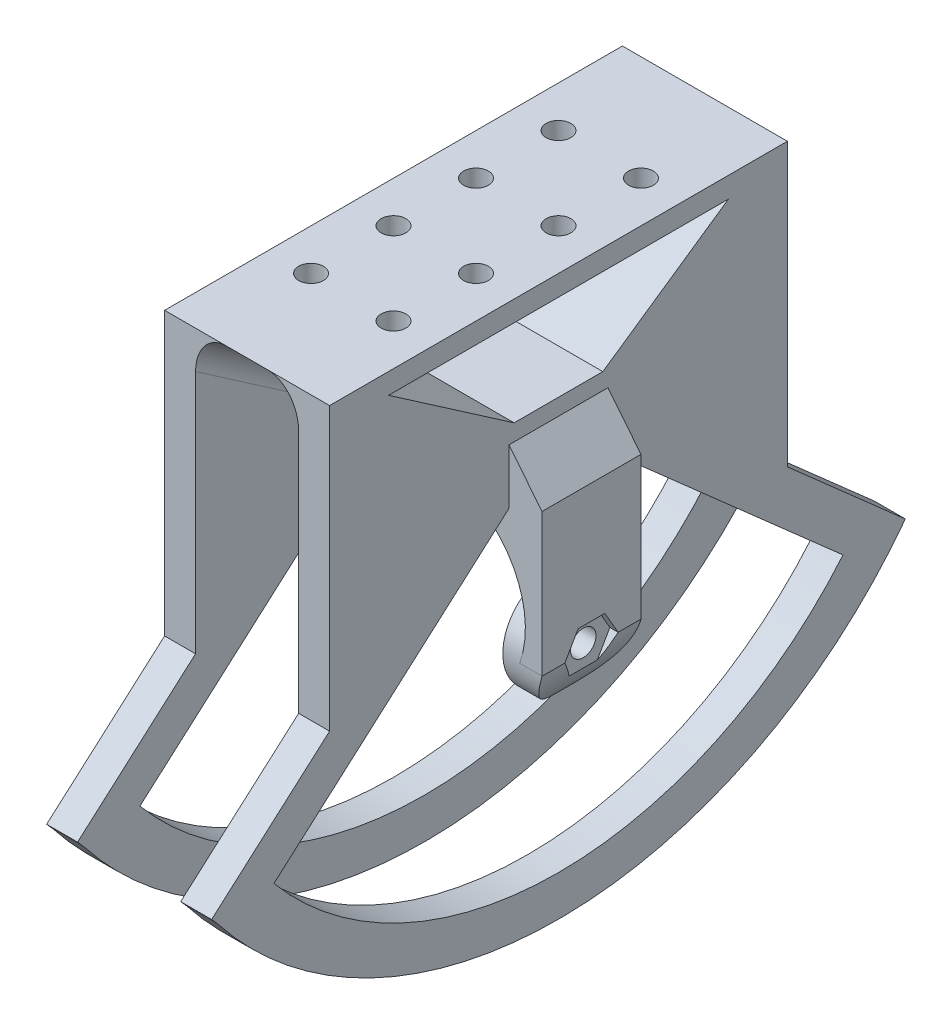
from build123d import *

# Parameters (mm, degrees)
EXTRUDE_1_DEPTH      = 12
EXTRUDE_2_REACH      = 35.545
EXTRUDE_2_END_RADIUS = 11.985372339
SKETCH_2_R           = 6
MIRROR_START         = 9.249795062
MIRROR_1_DEPTH       = 2.735782315
MIRROR_1_2_DEPTH     = 0.000409876
CUT_EXTRUDE_1_DEPTH  = 34.545141776
CUT_EXTRUDE_2_DEPTH  = 1
CUT_EXTRUDE_3_DEPTH  = 1
MIRROR_START_2       = 9.250204938
MIRROR_3_DEPTH       = 5.749795062
SKETCH_6_R           = 1.55
CUT_EXTRUDE_4_DEPTH  = 37.245193425
SKETCH_12_W          = 20
SKETCH_12_H          = 12
EXTRUDE_4_DEPTH      = 5
EXTRUDE_5_DEPTH      = 10
EXTRUDE_6_DEPTH      = 12
EXTRUDE_7_DEPTH      = 3.75
EXTRUDE_8_DEPTH      = 3.75
FILLET_1_R           = 3.75
SKETCH_21_R          = 1.5
CUT_EXTRUDE_5_DEPTH  = 3


with BuildPart() as part:
    # 스케치1 → 보스-돌출1 (new body)
    with BuildSketch(Plane.XY):
        with BuildLine():
            Line((14.000204938, 2.291069809), (-13.999795062, 2.291069809))
            Line((-13.999795062, 2.291069809), (-13.999795062, -6.939240191))
            Line((-13.999795062, -6.939240191), (-13.999795062, -15.005030191))
            ThreePointArc((-13.999795062, -15.005030191), (-12.699794, -18.209549332), (-10.647895062, -20.993190191))
            Line((-10.647895062, -20.993190191), (-9.249795062, -20.993190191))
            Line((-9.249795062, -20.993190191), (-9.249795062, -18.61185417))
            ThreePointArc((-9.249795062, -18.61185417), (-10.428409882, -16.897436148), (-11.292795062, -15.005030191))
            ThreePointArc((-11.292795062, -15.005030191), (0.000204938, 0.99497801), (11.293204938, -15.005030191))
            ThreePointArc((11.293204938, -15.005030191), (10.428819757, -16.897436148), (9.250204938, -18.61185417))
            Line((9.250204938, -18.61185417), (9.250204938, -20.993190191))
            Line((9.250204938, -20.993190191), (10.648304938, -20.993190191))
            ThreePointArc((10.648304938, -20.993190191), (12.700203875, -18.209549332), (14.000204938, -15.005030191))
            Line((14.000204938, -15.005030191), (14.000204938, -6.939240191))
            Line((14.000204938, -6.939240191), (14.000204938, 2.291069809))
        make_face()
    extrude(amount=EXTRUDE_1_DEPTH)

    # 보스-돌출2: up to this cylinder (the profile starts inside it)
    extrude_2_end = Plane(origin=(0.000204938, -10.990394329, 6), z_dir=(0, 0, -1)) * Cylinder(EXTRUDE_2_END_RADIUS, 96.060744678, mode=Mode.PRIVATE)
    # 스케치2 → 보스-돌출2 (add, up to the surface)
    with BuildSketch(Plane(origin=(-9.249795062, 0, 0), x_dir=(0, 0, -1), z_dir=(1, 0, 0)), mode=Mode.PRIVATE) as extrude_2_sk1:
        with Locations((-6, -14.993190191)):
            Circle(SKETCH_2_R)
    extrude_2_tool1 = extrude(extrude_2_sk1.sketch, amount=-EXTRUDE_2_REACH, mode=Mode.PRIVATE) & extrude_2_end
    add(extrude_2_tool1.solids().sort_by_distance((-9.249795, -14.99319, 6))[0])

    # 대칭 복사1: read off the stored shape, not the designer's step
    # 대칭 복사1 outline → 대칭 복사1 (add)
    with BuildSketch(Plane.YZ.offset(MIRROR_START)):
        with BuildLine():
            ThreePointArc((-18.61185417, 1.214054847), (-8.993190191, 6), (-18.61185417, 10.785945153))
            Line((-18.61185417, 10.785945153), (-18.61185417, 1.214054847))
        make_face()
    extrude(amount=MIRROR_1_DEPTH)

    # Mirror 1 2 outline → Mirror 1 2 (add)
    with BuildSketch(Plane.YZ.offset(MIRROR_START)):
        with BuildLine():
            Line((-18.61185417, 1.214054847), (-18.61185417, 10.785945153))
            ThreePointArc((-18.61185417, 10.785945153), (-20.993190191, 6), (-18.61185417, 1.214054847))
        make_face()
    extrude(amount=MIRROR_1_2_DEPTH)

    # 스케치3 → 컷-돌출1 (cut, through all)
    with BuildSketch(Plane(origin=(-9.249795062, 0, 0), x_dir=(0, 0, -1), z_dir=(1, 0, 0))):
        with BuildLine():
            Line((-6, -20.993190191), (0, -20.993190191))
            Line((0, -20.993190191), (0, -18.61185417))
            Line((0, -18.61185417), (-1.214054847, -18.61185417))
            ThreePointArc((-1.214054847, -18.61185417), (-3.327172272, -20.364967545), (-6, -20.993190191))
        make_face()
        with BuildLine():
            Line((-12, -20.993190191), (-6, -20.993190191))
            ThreePointArc((-6, -20.993190191), (-8.672827728, -20.364967545), (-10.785945153, -18.61185417))
            Line((-10.785945153, -18.61185417), (-12, -18.61185417))
            Line((-12, -18.61185417), (-12, -20.993190191))
        make_face()
        with BuildLine():
            Line((-12, -18.61185417), (-10.785945153, -18.61185417))
            ThreePointArc((-10.785945153, -18.61185417), (-11.688394805, -16.901635773), (-12, -14.993190191))
            Line((-12, -14.993190191), (-12, -18.61185417))
        make_face()
        with BuildLine():
            Line((-1.214054847, -18.61185417), (0, -18.61185417))
            Line((0, -18.61185417), (0, -14.993190191))
            ThreePointArc((0, -14.993190191), (-0.311605195, -16.901635773), (-1.214054847, -18.61185417))
        make_face()
    extrude(amount=-CUT_EXTRUDE_1_DEPTH, mode=Mode.SUBTRACT)

    # 스케치4 → 컷-돌출2 (cut)
    with BuildSketch(Plane.ZY.offset(13.999795062)):
        Polygon((9.23, -15.005030191), (7.615, -12.207768137), (4.385, -12.207768137), (2.77, -15.005030191), (4.385, -17.802292245), (7.615, -17.802292245), align=None)
    extrude(amount=-CUT_EXTRUDE_2_DEPTH, mode=Mode.SUBTRACT)

    # 스케치5 → 컷-돌출3 (cut)
    with BuildSketch(Plane(origin=(14.000204938, 0, 0), x_dir=(0, 0, -1), z_dir=(1, 0, 0))):
        Polygon((-2.77, -15.005030191), (-4.385, -12.207768137), (-7.615, -12.207768137), (-9.23, -15.005030191), (-7.615, -17.802292245), (-4.385, -17.802292245), align=None)
    extrude(amount=-CUT_EXTRUDE_3_DEPTH, mode=Mode.SUBTRACT)

    # 대칭 복사3: read off the stored shape, not the designer's step
    # 대칭 복사3 outline → 대칭 복사3 (cut)
    with BuildSketch(Plane.YZ.offset(MIRROR_START_2)):
        with BuildLine():
            ThreePointArc((-20.993190191, 6), (-19.235830878, 10.242640687), (-14.993190191, 12))
            Line((-14.993190191, 12), (-20.993190191, 12))
            Line((-20.993190191, 12), (-20.993190191, 6))
        make_face()
        with BuildLine():
            Line((-20.993190191, 0), (-14.993190191, 0))
            ThreePointArc((-14.993190191, 0), (-19.235830878, 1.757359313), (-20.993190191, 6))
            Line((-20.993190191, 6), (-20.993190191, 0))
        make_face()
    extrude(amount=MIRROR_3_DEPTH, mode=Mode.SUBTRACT)

    # 스케치6 → 컷-돌출4 (cut, through all)
    with BuildSketch(Plane.ZY.offset(12.999795062)):
        with Locations((6, -15.005030191)):
            Circle(SKETCH_6_R)
    extrude(amount=-CUT_EXTRUDE_4_DEPTH, mode=Mode.SUBTRACT)

    # 스케치12 → 보스-돌출4 (add)
    with BuildSketch(Plane(origin=(0, 2.291069809, 0), x_dir=(1, 0, 0), z_dir=(0, 1, 0))):
        with Locations((0, -6)):
            Rectangle(SKETCH_12_W, SKETCH_12_H)
    extrude(amount=EXTRUDE_4_DEPTH)

    # 스케치14 → 보스-돌출5 (add, symmetric)
    with BuildSketch(Plane(origin=(0, 0, 0), x_dir=(0, 0, -1), z_dir=(1, 0, 0))):
        Polygon((-12, 7.291069809), (0, 7.291069809), (21.75, 22.291069809), (-33.75, 22.291069809), align=None)
        Polygon((-11.377217009, 9.291069809), (-0.622782991, 9.291069809), (14.602217009, 19.791069809), (-26.602217009, 19.791069809), align=None, mode=Mode.SUBTRACT)
    extrude(amount=EXTRUDE_5_DEPTH, both=True)

    # 스케치15 → 보스-돌출6 (add)
    with BuildSketch(Plane.XY.offset(12)):
        Polygon((-10, 7.291069809), (-13.999795062, 2.291069809), (-10, 2.291069809), align=None)
        Polygon((10, 2.291069809), (14.000204938, 2.291069809), (10, 7.291069809), align=None)
    extrude(amount=-EXTRUDE_6_DEPTH)

    # 스케치19 → 보스-돌출7 (add)
    with BuildSketch(Plane(origin=(6.25, 0, 0), x_dir=(0, 0, -1), z_dir=(1, 0, 0))):
        with BuildLine():
            Line((-12, 0.623337928), (-12, 7.291069809))
            Line((-12, 7.291069809), (-48.053184311, -24.516461273))
            Line((-48.053184311, -24.516461273), (-47.300067067, -25.370104227))
            ThreePointArc((-47.300067067, -25.370104227), (-5.412725687, -45.518439989), (36.053184311, -24.516461273))
            Line((36.053184311, -24.516461273), (0, 7.291069809))
            Line((0, 7.291069809), (0, 0.623337928))
            Line((0, 0.623337928), (28.495446937, -24.516461273))
            ThreePointArc((28.495446937, -24.516461273), (-6, -40.618984902), (-40.495446937, -24.516461273))
            Line((-40.495446937, -24.516461273), (-12, 0.623337928))
        make_face()
    extrude_7 = extrude(amount=EXTRUDE_7_DEPTH)

    # 대칭 복사4: 보스-돌출7 across plane
    add(extrude_7.mirror(Plane(origin=(0, 0, 0), x_dir=(0, 0, 1), z_dir=(1, 0, 0))))

    # 스케치20 → 보스-돌출8 (add)
    with BuildSketch(Plane(origin=(10, 0, 0), x_dir=(0, 0, -1), z_dir=(1, 0, 0))):
        Polygon((-12, 7.291069809), (-33.75, 22.291069809), (-33.75, -11.897631945), align=None)
        Polygon((21.75, 22.291069809), (21.75, -11.897631945), (0, 7.291069809), align=None)
    extrude_8 = extrude(amount=-EXTRUDE_8_DEPTH)

    # 대칭 복사5: 보스-돌출8 across plane
    add(extrude_8.mirror(Plane(origin=(0, 0, 0), x_dir=(0, 0, 1), z_dir=(1, 0, 0))))

    # 필렛1
    # the kernel refuses this fillet: 3.75 mm, written as the material it adds along each edge
    with BuildSketch(Plane(origin=(-6.25, 7.291069809, 0), x_dir=(0, -1, 0), z_dir=(1, 0, 0))) as fillet_1_piece_1_section:
        with BuildLine():
            CenterArc((FILLET_1_R * 0.525097583021, FILLET_1_R), FILLET_1_R, 214.592288688, 55.407711312)
            Line((-FILLET_1_R * 0.298115202894, FILLET_1_R * 0.432267044196), (0, 0))
            Line((0, 0), (FILLET_1_R * 0.525097583021, 0))
        make_face()
    fillet_1_piece_1 = extrude(amount=17.422789841, mode=Mode.PRIVATE)
    fillet_1_piece_1 = split(fillet_1_piece_1, bisect_by=Plane(origin=(10, 7.291069809, 0), z_dir=(-1, 0, 0)), keep=Keep.TOP, mode=Mode.PRIVATE)
    add(fillet_1_piece_1)
    with BuildSketch(Plane(origin=(11.172789841, 7.291069809, 12), x_dir=(0, -1, 0), z_dir=(-1, 0, 0))) as fillet_1_piece_2_section:
        with BuildLine():
            CenterArc((FILLET_1_R * 0.525097583021, FILLET_1_R), FILLET_1_R, 214.592288688, 55.407711312)
            Line((-FILLET_1_R * 0.298115202894, FILLET_1_R * 0.432267044196), (0, 0))
            Line((0, 0), (FILLET_1_R * 0.525097583021, 0))
        make_face()
    fillet_1_piece_2 = extrude(amount=17.422789841, mode=Mode.PRIVATE)
    fillet_1_piece_2 = split(fillet_1_piece_2, bisect_by=Plane(origin=(10, 7.291069809, 12), z_dir=(-1, 0, 0)), keep=Keep.TOP, mode=Mode.PRIVATE)
    add(fillet_1_piece_2)
    with BuildSketch(Plane(origin=(6.25, 1.968573348, 4.282380132), x_dir=(-1, 0, 0), z_dir=(0, 0.5677329558036596, 0.8232127859153063))) as fillet_1_piece_3_section:
        with BuildLine():
            CenterArc((FILLET_1_R, FILLET_1_R), FILLET_1_R, 180, 90)
            Line((0, FILLET_1_R), (0, 0))
            Line((0, 0), (FILLET_1_R, 0))
        make_face()
    fillet_1_piece_3 = extrude(amount=45.170872431, mode=Mode.PRIVATE)
    fillet_1_piece_3 = split(fillet_1_piece_3, bisect_by=Plane(origin=(6.25, 1.968573348, 12), z_dir=(0, 0, 1)), keep=Keep.TOP, mode=Mode.PRIVATE)
    fillet_1_piece_3 = split(fillet_1_piece_3, bisect_by=Plane(origin=(6.25, 1.968573348, 33.75), z_dir=(0, 0, -1)), keep=Keep.TOP, mode=Mode.PRIVATE)
    add(fillet_1_piece_3)
    with BuildSketch(Plane(origin=(6.25, 1.968573348, 7.717619868), x_dir=(0, -0.8232127859153062, -0.5677329558036597), z_dir=(0, 0.5677329558036597, -0.8232127859153062))) as fillet_1_piece_4_section:
        with BuildLine():
            CenterArc((FILLET_1_R, FILLET_1_R), FILLET_1_R, 180, 90)
            Line((0, FILLET_1_R), (0, 0))
            Line((0, 0), (FILLET_1_R, 0))
        make_face()
    fillet_1_piece_4 = extrude(amount=45.170872431, mode=Mode.PRIVATE)
    fillet_1_piece_4 = split(fillet_1_piece_4, bisect_by=Plane(origin=(6.25, 1.968573348, 0), z_dir=(0, 0, -1)), keep=Keep.TOP, mode=Mode.PRIVATE)
    fillet_1_piece_4 = split(fillet_1_piece_4, bisect_by=Plane(origin=(6.25, 1.968573348, -21.75), z_dir=(0, 0, 1)), keep=Keep.TOP, mode=Mode.PRIVATE)
    add(fillet_1_piece_4)
    with BuildSketch(Plane(origin=(-6.25, 1.968573348, 4.282380132), x_dir=(0, -0.8232127859153063, 0.5677329558036595), z_dir=(0, 0.5677329558036596, 0.8232127859153063))) as fillet_1_piece_5_section:
        with BuildLine():
            CenterArc((FILLET_1_R, FILLET_1_R), FILLET_1_R, 180, 90)
            Line((0, FILLET_1_R), (0, 0))
            Line((0, 0), (FILLET_1_R, 0))
        make_face()
    fillet_1_piece_5 = extrude(amount=45.170872431, mode=Mode.PRIVATE)
    fillet_1_piece_5 = split(fillet_1_piece_5, bisect_by=Plane(origin=(-6.25, 1.968573348, 12), z_dir=(0, 0, 1)), keep=Keep.TOP, mode=Mode.PRIVATE)
    fillet_1_piece_5 = split(fillet_1_piece_5, bisect_by=Plane(origin=(-6.25, 1.968573348, 33.75), z_dir=(0, 0, -1)), keep=Keep.TOP, mode=Mode.PRIVATE)
    add(fillet_1_piece_5)
    with BuildSketch(Plane(origin=(-6.25, 1.968573348, 7.717619868), x_dir=(0, -0.8232127859153062, -0.5677329558036597), z_dir=(0, 0.5677329558036597, -0.8232127859153062))) as fillet_1_piece_6_section:
        with BuildLine():
            CenterArc((FILLET_1_R, -FILLET_1_R), FILLET_1_R, 90, 90)
            Line((0, -FILLET_1_R), (0, 0))
            Line((0, 0), (FILLET_1_R, 0))
        make_face()
    fillet_1_piece_6 = extrude(amount=45.170872431, mode=Mode.PRIVATE)
    fillet_1_piece_6 = split(fillet_1_piece_6, bisect_by=Plane(origin=(-6.25, 1.968573348, 0), z_dir=(0, 0, -1)), keep=Keep.TOP, mode=Mode.PRIVATE)
    fillet_1_piece_6 = split(fillet_1_piece_6, bisect_by=Plane(origin=(-6.25, 1.968573348, -21.75), z_dir=(0, 0, 1)), keep=Keep.TOP, mode=Mode.PRIVATE)
    add(fillet_1_piece_6)

    # 스케치21 → 컷-돌출5 (cut)
    with BuildSketch(Plane(origin=(0, 22.291069809, 0), x_dir=(1, 0, 0), z_dir=(0, 1, 0))):
        with Locations(Location((5, 9, 0), (0, 0, 270))):
            Circle(SKETCH_21_R)
        with Locations(Location((5, -1, 0), (0, 0, 270))):
            Circle(SKETCH_21_R)
        with Locations(Location((-5, 9, 0), (0, 0, 90))):
            Circle(SKETCH_21_R)
        with Locations(Location((-5, -1, 0), (0, 0, 90))):
            Circle(SKETCH_21_R)
        with Locations(Location((5, -11, 0), (0, 0, 90))):
            Circle(SKETCH_21_R)
        with Locations(Location((5, -21, 0), (0, 0, 90))):
            Circle(SKETCH_21_R)
        with Locations(Location((-5, -21, 0), (0, 0, 270))):
            Circle(SKETCH_21_R)
        with Locations(Location((-5, -11, 0), (0, 0, 270))):
            Circle(SKETCH_21_R)
    extrude(amount=-CUT_EXTRUDE_5_DEPTH, mode=Mode.SUBTRACT)


solid = part.part
